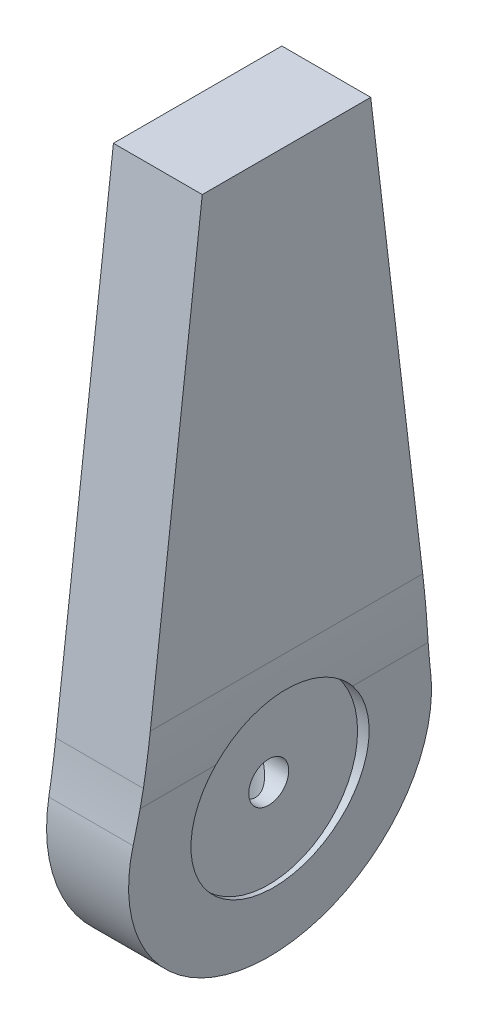
from build123d import *

# Parameters (mm, degrees)
SALIENTE_EXTRUIR1_DEPTH    = 10
CROQUIS3_R                 = 10
CORTAR_EXTRUIR1_DEPTH      = 2
CORTAR_EXTRUIR4_START      = -17
CORTAR_EXTRUIR4_DEPTH      = 34
CORTAR_EXTRUIR5_DEPTH      = 66.741919668
CORTAR_EXTRUIR5_DEPTH_BACK = 10
CROQUIS7_R                 = 2.25
CROQUIS8_R                 = 2.5
CORTAR_EXTRUIR6_DEPTH      = 19
CORTAR_EXTRUIR19_START     = -11
CROQUIS12_R                = 3.5
CORTAR_EXTRUIR19_DEPTH     = 5


# Read off the part's stored shape, not the designer's step: Cortar-Extruir4
with BuildPart() as part:
    # Croquis1 → Saliente-Extruir1 (new body)
    with BuildSketch(Plane(origin=(0, 0, 0), x_dir=(0, 0, -1), z_dir=(1, 0, 0))):
        with BuildLine():
            Line((-15.962347901, 8.291103532), (-9.477641645, 63))
            Line((-9.477641645, 63), (9.477641645, 63))
            Line((9.477641645, 63), (15.962347901, 8.291103532))
            ThreePointArc((15.962347901, 8.291103532), (16.318766271, 5.597695791), (16.748223211, 2.914964711))
            ThreePointArc((16.748223211, 2.914964711), (0, -17), (-16.748223211, 2.914964711))
            ThreePointArc((-16.748223211, 2.914964711), (-16.318766271, 5.597695791), (-15.962347901, 8.291103532))
        make_face()
    extrude(amount=-SALIENTE_EXTRUIR1_DEPTH)

    # Croquis3 → Cortar-Extruir1 (cut)
    with BuildSketch(Plane(origin=(0, 0, 0), x_dir=(0, 0, -1), z_dir=(1, 0, 0))):
        Circle(CROQUIS3_R)
    extrude(amount=-CORTAR_EXTRUIR1_DEPTH, mode=Mode.SUBTRACT)

    # Cortar-Extruir4 outline → Cortar-Extruir4 (cut)
    with BuildSketch(Plane.XY.offset(CORTAR_EXTRUIR4_START)):
        with BuildLine():
            ThreePointArc((0, 13.631567896), (-0.065876274, 10.002392341), (-0.263418304, 6.377998318))
            Line((-0.263418304, 6.377998318), (-1.963636364, -17))
            Line((-1.963636364, -17), (-2.109090909, -19))
            Line((-2.109090909, -19), (0, -19))
            Line((0, -19), (0, 13.631567896))
        make_face()
    extrude(amount=CORTAR_EXTRUIR4_DEPTH, mode=Mode.SUBTRACT)

    # Croquis7 → Cortar-Extruir5 (cut, two sides: drawn at the far end of the back side and taken through both)
    with BuildSketch(Plane(origin=(-2, 0, 0), x_dir=(0, 0, -1), z_dir=(1, 0, 0)).offset(-CORTAR_EXTRUIR5_DEPTH_BACK)):
        with Locations(Location((0, 0, 0), (0, 0, 180))):
            Circle(CROQUIS7_R)
    extrude(amount=CORTAR_EXTRUIR5_DEPTH + CORTAR_EXTRUIR5_DEPTH_BACK, mode=Mode.SUBTRACT)

    # Croquis8 → Cortar-Extruir6 (cut)
    with BuildSketch(Plane(origin=(0, 0, 0), x_dir=(1, 0, 0), z_dir=(0, 1, 0))):
        with Locations(Location((-6, 0, 0), (0, 0, 270))):
            Circle(CROQUIS8_R)
    extrude(amount=-CORTAR_EXTRUIR6_DEPTH, mode=Mode.SUBTRACT)

    # Croquis12 → Cortar-Extruir19 (cut)
    with BuildSketch(Plane(origin=(0, 0, 0), x_dir=(1, 0, 0), z_dir=(0, 1, 0)).offset(CORTAR_EXTRUIR19_START)):
        with Locations(Location((-6, 0, 0), (0, 0, 270))):
            Circle(CROQUIS12_R)
    extrude(amount=-CORTAR_EXTRUIR19_DEPTH, mode=Mode.SUBTRACT)


solid = part.part
